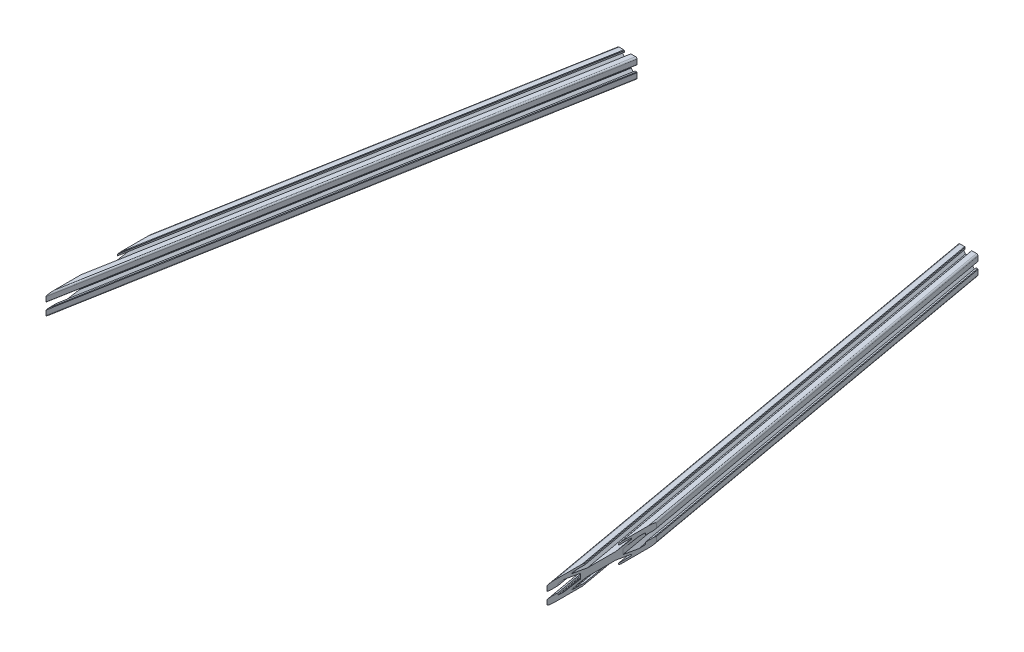
from build123d import *

# Parameters (mm, degrees)
ALUMINUM_START                        = -327.333270634
ALUMINUM_PROFILES_VRC_15X15_2_DEPTH   = 396.232255124
ALUMINUM_PROFILES_VRC_15X15_2_2_DEPTH = 396.232255123
CUT_EXTRUDE2_DEPTH                    = 565.121390002
CUT_EXTRUDE2_DEPTH_BACK               = 565.121390002
SKETCH5_W                             = 23.238168361
SKETCH5_H                             = 113.39268938
SKETCH5_W_2                           = 161.911998808
SKETCH5_H_2                           = 133.487324877
SKETCH5_W_3                           = 195.704106921
SKETCH5_H_3                           = 154.963599137
SKETCH5_W_4                           = 70


# Read off the part's stored shape, not the designer's step: Aluminum profiles VRC_15X15(2)
with BuildPart() as part:
    # Aluminum profiles VRC_15X15(2) outline → Aluminum profiles VRC_15X15(2) (new body)
    with BuildSketch(Plane(origin=(0, 0, 0), x_dir=(0.984271206993884, 0, -0.17666406279377403), z_dir=(0.17666406279377403, 0, 0.9842712069938842)).offset(ALUMINUM_START)):
        with BuildLine():
            Line((389.415770728, 4.575), (393.315770728, 4.575))
            Line((393.315770728, 4.575), (395.490770728, 2.4))
            Line((395.490770728, 2.4), (395.490770728, 1.875))
            ThreePointArc((395.490770728, 1.875), (395.380935771, 1.609834957), (395.115770728, 1.5))
            Line((395.115770728, 1.5), (393.690770728, 1.5))
            Line((393.690770728, 1.5), (393.690770728, 0.375))
            Line((393.690770728, 0.375), (394.065770728, 0))
            Line((394.065770728, 0), (397.740770728, 0))
            ThreePointArc((397.740770728, 0), (398.536265856, 0.329504871), (398.865770728, 1.125))
            Line((398.865770728, 1.125), (398.865770728, 4.8))
            Line((398.865770728, 4.8), (398.490770728, 5.175))
            Line((398.490770728, 5.175), (397.365770728, 5.175))
            Line((397.365770728, 5.175), (397.365770728, 3.75))
            ThreePointArc((397.365770728, 3.75), (397.255935771, 3.484834957), (396.990770728, 3.375))
            Line((396.990770728, 3.375), (396.465770728, 3.375))
            Line((396.465770728, 3.375), (394.290770728, 5.55))
            Line((394.290770728, 5.55), (394.290770728, 9.45))
            Line((394.290770728, 9.45), (396.465770728, 11.625))
            Line((396.465770728, 11.625), (396.990770728, 11.625))
            ThreePointArc((396.990770728, 11.625), (397.255935771, 11.515165043), (397.365770728, 11.25))
            Line((397.365770728, 11.25), (397.365770728, 9.825))
            Line((397.365770728, 9.825), (398.490770728, 9.825))
            Line((398.490770728, 9.825), (398.865770728, 10.2))
            Line((398.865770728, 10.2), (398.865770728, 13.875))
            ThreePointArc((398.865770728, 13.875), (398.536265856, 14.670495129), (397.740770728, 15))
            Line((397.740770728, 15), (394.065770728, 15))
            Line((394.065770728, 15), (393.690770728, 14.625))
            Line((393.690770728, 14.625), (393.690770728, 13.5))
            Line((393.690770728, 13.5), (395.115770728, 13.5))
            ThreePointArc((395.115770728, 13.5), (395.380935771, 13.390165043), (395.490770728, 13.125))
            Line((395.490770728, 13.125), (395.490770728, 12.6))
            Line((395.490770728, 12.6), (393.315770728, 10.425))
            Line((393.315770728, 10.425), (389.415770728, 10.425))
            Line((389.415770728, 10.425), (387.240770728, 12.6))
            Line((387.240770728, 12.6), (387.240770728, 13.125))
            ThreePointArc((387.240770728, 13.125), (387.350605685, 13.390165043), (387.615770728, 13.5))
            Line((387.615770728, 13.5), (389.040770728, 13.5))
            Line((389.040770728, 13.5), (389.040770728, 14.625))
            Line((389.040770728, 14.625), (388.665770728, 15))
            Line((388.665770728, 15), (384.990770728, 15))
            ThreePointArc((384.990770728, 15), (384.195275599, 14.670495129), (383.865770728, 13.875))
            Line((383.865770728, 13.875), (383.865770728, 10.2))
            Line((383.865770728, 10.2), (384.240770728, 9.825))
            Line((384.240770728, 9.825), (385.365770728, 9.825))
            Line((385.365770728, 9.825), (385.365770728, 11.25))
            ThreePointArc((385.365770728, 11.25), (385.475605685, 11.515165043), (385.740770728, 11.625))
            Line((385.740770728, 11.625), (386.265770728, 11.625))
            Line((386.265770728, 11.625), (388.440770728, 9.45))
            Line((388.440770728, 9.45), (388.440770728, 5.55))
            Line((388.440770728, 5.55), (386.265770728, 3.375))
            Line((386.265770728, 3.375), (385.740770728, 3.375))
            ThreePointArc((385.740770728, 3.375), (385.475605685, 3.484834957), (385.365770728, 3.75))
            Line((385.365770728, 3.75), (385.365770728, 5.175))
            Line((385.365770728, 5.175), (384.240770728, 5.175))
            Line((384.240770728, 5.175), (383.865770728, 4.8))
            Line((383.865770728, 4.8), (383.865770728, 1.125))
            ThreePointArc((383.865770728, 1.125), (384.195275599, 0.329504871), (384.990770728, 0))
            Line((384.990770728, 0), (388.665770728, 0))
            Line((388.665770728, 0), (389.040770728, 0.375))
            Line((389.040770728, 0.375), (389.040770728, 1.5))
            Line((389.040770728, 1.5), (387.615770728, 1.5))
            ThreePointArc((387.615770728, 1.5), (387.350605685, 1.609834957), (387.240770728, 1.875))
            Line((387.240770728, 1.875), (387.240770728, 2.4))
            Line((387.240770728, 2.4), (389.415770728, 4.575))
        make_face()
    extrude(amount=ALUMINUM_PROFILES_VRC_15X15_2_DEPTH)


with BuildPart() as body_2:
    # Aluminum profiles VRC_15X15_2 2 outline → Aluminum profiles VRC_15X15_2 2 (new body)
    with BuildSketch(Plane(origin=(0, 0, 0), x_dir=(0.984271206993884, 0, 0.17666406279377403), z_dir=(0.17666406279377403, 0, -0.9842712069938842))):
        with BuildLine():
            Line((-5.55, -4.575), (-9.45, -4.575))
            Line((-9.45, -4.575), (-11.625, -2.4))
            Line((-11.625, -2.4), (-11.625, -1.875))
            ThreePointArc((-11.625, -1.875), (-11.515165043, -1.609834957), (-11.25, -1.5))
            Line((-11.25, -1.5), (-9.825, -1.5))
            Line((-9.825, -1.5), (-9.825, -0.375))
            Line((-9.825, -0.375), (-10.2, 0))
            Line((-10.2, 0), (-13.875, 0))
            ThreePointArc((-13.875, 0), (-14.670495129, -0.329504871), (-15, -1.125))
            Line((-15, -1.125), (-15, -4.8))
            Line((-15, -4.8), (-14.625, -5.175))
            Line((-14.625, -5.175), (-13.5, -5.175))
            Line((-13.5, -5.175), (-13.5, -3.75))
            ThreePointArc((-13.5, -3.75), (-13.390165043, -3.484834957), (-13.125, -3.375))
            Line((-13.125, -3.375), (-12.6, -3.375))
            Line((-12.6, -3.375), (-10.425, -5.55))
            Line((-10.425, -5.55), (-10.425, -9.45))
            Line((-10.425, -9.45), (-12.6, -11.625))
            Line((-12.6, -11.625), (-13.125, -11.625))
            ThreePointArc((-13.125, -11.625), (-13.390165043, -11.515165043), (-13.5, -11.25))
            Line((-13.5, -11.25), (-13.5, -9.825))
            Line((-13.5, -9.825), (-14.625, -9.825))
            Line((-14.625, -9.825), (-15, -10.2))
            Line((-15, -10.2), (-15, -13.875))
            ThreePointArc((-15, -13.875), (-14.670495129, -14.670495129), (-13.875, -15))
            Line((-13.875, -15), (-10.2, -15))
            Line((-10.2, -15), (-9.825, -14.625))
            Line((-9.825, -14.625), (-9.825, -13.5))
            Line((-9.825, -13.5), (-11.25, -13.5))
            ThreePointArc((-11.25, -13.5), (-11.515165043, -13.390165043), (-11.625, -13.125))
            Line((-11.625, -13.125), (-11.625, -12.6))
            Line((-11.625, -12.6), (-9.45, -10.425))
            Line((-9.45, -10.425), (-5.55, -10.425))
            Line((-5.55, -10.425), (-3.375, -12.6))
            Line((-3.375, -12.6), (-3.375, -13.125))
            ThreePointArc((-3.375, -13.125), (-3.484834957, -13.390165043), (-3.75, -13.5))
            Line((-3.75, -13.5), (-5.175, -13.5))
            Line((-5.175, -13.5), (-5.175, -14.625))
            Line((-5.175, -14.625), (-4.8, -15))
            Line((-4.8, -15), (-1.125, -15))
            ThreePointArc((-1.125, -15), (-0.329504871, -14.670495129), (0, -13.875))
            Line((0, -13.875), (0, -10.2))
            Line((0, -10.2), (-0.375, -9.825))
            Line((-0.375, -9.825), (-1.5, -9.825))
            Line((-1.5, -9.825), (-1.5, -11.25))
            ThreePointArc((-1.5, -11.25), (-1.609834957, -11.515165043), (-1.875, -11.625))
            Line((-1.875, -11.625), (-2.4, -11.625))
            Line((-2.4, -11.625), (-4.575, -9.45))
            Line((-4.575, -9.45), (-4.575, -5.55))
            Line((-4.575, -5.55), (-2.4, -3.375))
            Line((-2.4, -3.375), (-1.875, -3.375))
            ThreePointArc((-1.875, -3.375), (-1.609834957, -3.484834957), (-1.5, -3.75))
            Line((-1.5, -3.75), (-1.5, -5.175))
            Line((-1.5, -5.175), (-0.375, -5.175))
            Line((-0.375, -5.175), (0, -4.8))
            Line((0, -4.8), (0, -1.125))
            ThreePointArc((0, -1.125), (-0.329504871, -0.329504871), (-1.125, 0))
            Line((-1.125, 0), (-4.8, 0))
            Line((-4.8, 0), (-5.175, -0.375))
            Line((-5.175, -0.375), (-5.175, -1.5))
            Line((-5.175, -1.5), (-3.75, -1.5))
            ThreePointArc((-3.75, -1.5), (-3.484834957, -1.609834957), (-3.375, -1.875))
            Line((-3.375, -1.875), (-3.375, -2.4))
            Line((-3.375, -2.4), (-5.55, -4.575))
        make_face()
    extrude(amount=ALUMINUM_PROFILES_VRC_15X15_2_2_DEPTH)


with BuildPart() as cut_extrude2_tool:
    # Sketch5 → Cut-Extrude2 (new, two sides: drawn at the far end of the back side and taken through both)
    with BuildSketch(Plane(origin=(0, 15, 0), x_dir=(1, 0, 0), z_dir=(0, 1, 0)).offset(-CUT_EXTRUDE2_DEPTH_BACK)):
        with Locations((-11.619084181, 56.69634469)):
            Rectangle(SKETCH5_W, SKETCH5_H)
        with Locations((470.955999404, 66.743662439)):
            Rectangle(SKETCH5_W_2, SKETCH5_H_2)
        with Locations((373.793651941, 467.481799569)):
            Rectangle(SKETCH5_W_3, SKETCH5_H_3)
        with Locations((35, 467.481799569)):
            Rectangle(SKETCH5_W_4, SKETCH5_H_3)
    extrude(amount=CUT_EXTRUDE2_DEPTH + CUT_EXTRUDE2_DEPTH_BACK)


with BuildPart() as part_1:
    add(part.part)

    # Cut-Extrude2: cut by cut_extrude2_tool
    add(cut_extrude2_tool.part, mode=Mode.SUBTRACT)


with BuildPart() as body_2_1:
    add(body_2.part)

    # Cut-Extrude2: cut by cut_extrude2_tool
    add(cut_extrude2_tool.part, mode=Mode.SUBTRACT)


solid = Compound([part_1.part, body_2_1.part])
